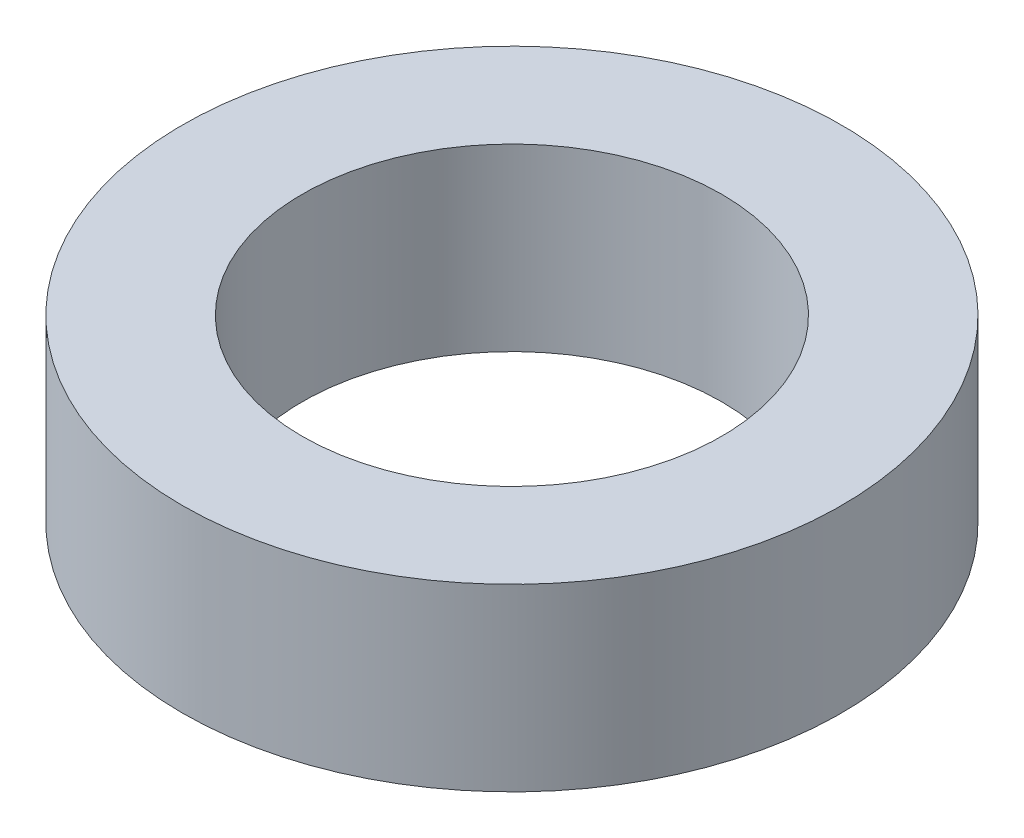
from build123d import *

# Parameters (mm, degrees)
SKETCH1_R           = 27.5
BOSS_EXTRUDE1_DEPTH = 15
SKETCH2_R           = 17.5
CUT_EXTRUDE1_DEPTH  = 42.683330001


with BuildPart() as part:
    # Sketch1 → Boss-Extrude1 (new body)
    with BuildSketch(Plane(origin=(0, 0, 0), x_dir=(1, 0, 0), z_dir=(0, 1, 0))):
        Circle(SKETCH1_R)
    extrude(amount=BOSS_EXTRUDE1_DEPTH)

    # Sketch2 → Cut-Extrude1 (cut, through all)
    with BuildSketch(Plane(origin=(0, 0, 0), x_dir=(1, 0, 0), z_dir=(0, 1, 0))):
        Circle(SKETCH2_R)
    extrude(amount=CUT_EXTRUDE1_DEPTH, mode=Mode.SUBTRACT)


solid = part.part
